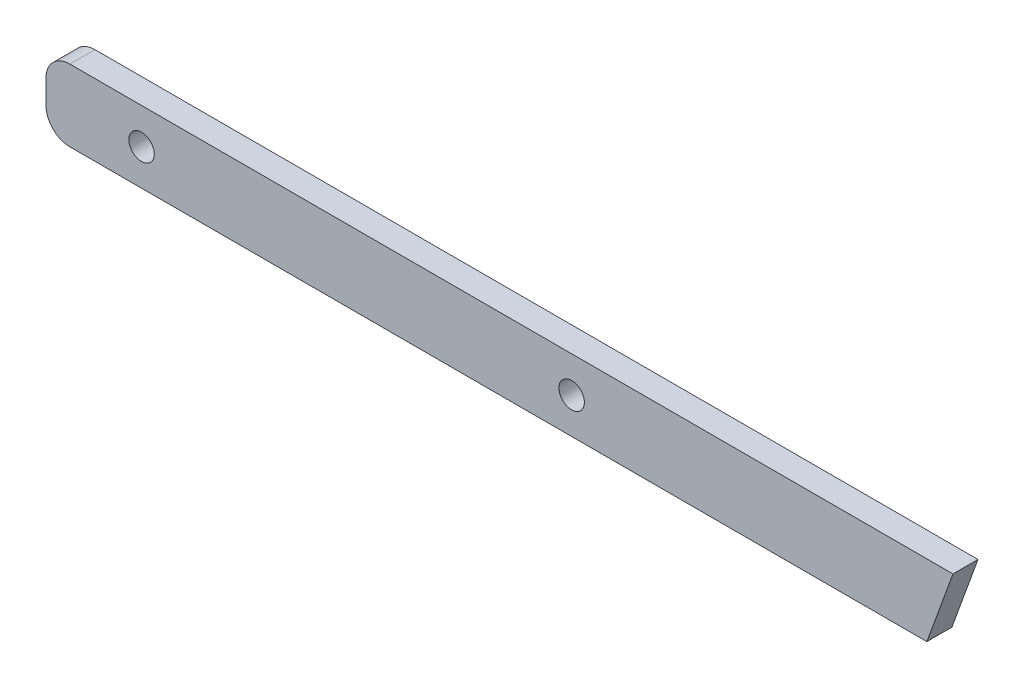
from build123d import *

# Parameters (mm, degrees)
STOCK_KEEL_BULB_SUPPORT_1_START     = -3.3274
STOCK_KEEL_BULB_SUPPORT_1_OUTLINE_R = 3.3782
STOCK_KEEL_BULB_SUPPORT_1_DEPTH     = 6.6548
FILLET1_R                           = 6.35


# Read off the part's stored shape, not the designer's step: Stock-Keel_bulb_support-1
with BuildPart() as part:
    # Stock-Keel_bulb_support-1 outline → Stock-Keel_bulb_support-1 (new body)
    with BuildSketch(Plane.XY.offset(STOCK_KEEL_BULB_SUPPORT_1_START)):
        Polygon((-223.965917593, 0), (10.136293283, 0), (17.069926246, 19.05), (-223.965917593, 19.05), align=None)
        with Locations((-198.565917593, 9.525)):
            Circle(STOCK_KEEL_BULB_SUPPORT_1_OUTLINE_R, mode=Mode.SUBTRACT)
        with Locations((-84.265917593, 9.525)):
            Circle(STOCK_KEEL_BULB_SUPPORT_1_OUTLINE_R, mode=Mode.SUBTRACT)
    extrude(amount=STOCK_KEEL_BULB_SUPPORT_1_DEPTH)

    # Fillet1
    fillet1_edges = [part.edges().sort_by_distance(p)[0] for p in [
        (-223.965917593, 19.05, 0),
        (-223.965917593, 0, 0),
    ]]
    fillet(fillet1_edges, radius=FILLET1_R)


solid = part.part
